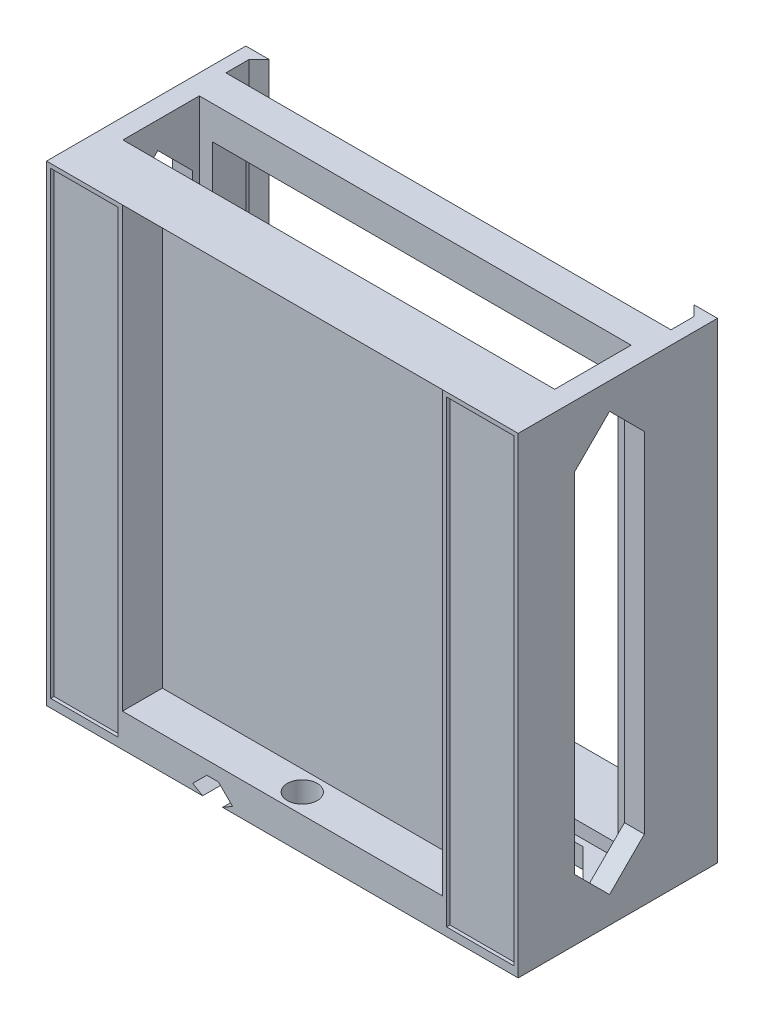
from build123d import *

# Parameters (mm, degrees)
SKETCH1_W            = 142
SKETCH1_H            = 142
SKETCH1_W_2          = 122
SKETCH1_H_2          = 122
BOSS_EXTRUDE1_DEPTH  = 10
SKETCH2_W            = 142
SKETCH2_H            = 10
BOSS_EXTRUDE2_DEPTH  = 10
BOSS_EXTRUDE3_DEPTH  = 132
BOSS_EXTRUDE4_DEPTH  = 2
SKETCH6_W            = 6
SKETCH6_H            = 8
BOSS_EXTRUDE5_DEPTH  = 21
BOSS_EXTRUDE6_DEPTH  = 142
BOSS_EXTRUDE7_DEPTH  = 6
BOSS_EXTRUDE8_DEPTH  = 6
SKETCH10_W           = 142
SKETCH10_H           = 142
BOSS_EXTRUDE9_DEPTH  = 12
BOSS_EXTRUDE14_DEPTH = 6
SKETCH13_R           = 4.5
CUT_EXTRUDE2_DEPTH   = 159.003164525
SKETCH14_W           = 20.32
SKETCH14_H           = 138.19
CUT_EXTRUDE3_DEPTH   = 1
CHAMFER4_SIZE        = 12
CUT_EXTRUDE4_DEPTH   = 117.970081645


with BuildPart() as part:
    # Sketch1 → Boss-Extrude1 (new body)
    with BuildSketch(Plane(origin=(0, 0, 0), x_dir=(0, 1, 0), z_dir=(0, 0, 1))):
        Rectangle(SKETCH1_W, SKETCH1_H)
        Rectangle(SKETCH1_W_2, SKETCH1_H_2, mode=Mode.SUBTRACT)
    extrude(amount=BOSS_EXTRUDE1_DEPTH)

    # Sketch2 → Boss-Extrude2 (add)
    with BuildSketch(Plane(origin=(0, 0, 0), x_dir=(1, 0, 0), z_dir=(0, 0, -1))):
        with Locations((0, 66)):
            Rectangle(SKETCH2_W, SKETCH2_H)
    extrude(amount=BOSS_EXTRUDE2_DEPTH)

    # Sketch3 → Boss-Extrude3 (add)
    with BuildSketch(Plane(origin=(0, -61, 0), x_dir=(-1, 0, 0), z_dir=(0, 1, 0))):
        Polygon((-67, -7), (-64, -10), (-71, -10), (-71, 0), (-67, 0), align=None)
        Polygon((64, -10), (71, -10), (71, 0), (67, 0), (67, -7), align=None)
    extrude(amount=BOSS_EXTRUDE3_DEPTH)

    # Sketch5 → Boss-Extrude4 (add)
    with BuildSketch(Plane.XY.offset(10)):
        Polygon((-65, -65), (65, -65), (65, 65), (65, 71), (71, 71), (71, 65), (71, -71), (-71, -71), (-71, 71), (-65, 71), (-65, 65), align=None)
    extrude(amount=BOSS_EXTRUDE4_DEPTH)

    # Sketch6 → Boss-Extrude5 (add)
    with BuildSketch(Plane.XY.offset(12)):
        with Locations((-68, 67)):
            Rectangle(SKETCH6_W, SKETCH6_H)
        Polygon((-65, -65), (-65, -63), (-71, -63), (-71, -71), (-63, -71), (-63, -65), align=None)
        Polygon((63, -71), (63, -65), (65, -65), (65, -63), (71, -63), (71, -71), align=None)
        with Locations((68, 67)):
            Rectangle(SKETCH6_W, SKETCH6_H)
    extrude(amount=BOSS_EXTRUDE5_DEPTH)

    # Sketch7 → Boss-Extrude6 (add)
    with BuildSketch(Plane.XZ.offset(71)):
        Polygon((-63, 33), (63, 33), (71, 33), (71, 38), (-71, 38), (-71, 33), align=None)
    extrude(amount=-BOSS_EXTRUDE6_DEPTH)

    # Sketch8 → Boss-Extrude7 (add)
    with BuildSketch(Plane.YZ.offset(71)):
        Polygon((63, 12), (63, 22.5), (52.5, 12), align=None)
        Polygon((52.5, 33), (63, 22.5), (63, 33), align=None)
    boss_extrude7 = extrude(amount=-BOSS_EXTRUDE7_DEPTH)

    # Sketch9 → Boss-Extrude8 (add)
    with BuildSketch(Plane(origin=(-71, 0, 0), x_dir=(0, -1, 0), z_dir=(-1, 0, 0))):
        Polygon((-52.5, 12), (-63, 22.5), (-63, 12), align=None)
        Polygon((-52.5, 33), (-63, 33), (-63, 22.5), align=None)
    boss_extrude8 = extrude(amount=-BOSS_EXTRUDE8_DEPTH)

    # Mirror4: Boss-Extrude7, Boss-Extrude8 across plane
    add(boss_extrude7.mirror(Plane.ZX))
    add(boss_extrude8.mirror(Plane.ZX))

    # Sketch10 → Boss-Extrude9 (add)
    with BuildSketch(Plane.XY.offset(38)):
        Rectangle(SKETCH10_W, SKETCH10_H)
        Polygon((-48.14, 59), (-48.14, -48.14), (-48.14, -61), (48.14, -61), (48.14, -48.14), (48.14, 59), align=None, mode=Mode.SUBTRACT)
    extrude(amount=BOSS_EXTRUDE9_DEPTH)

    # Sketch11 → Boss-Extrude14 (add)
    with BuildSketch(Plane.XZ.offset(71)):
        Polygon((-52.5, 12), (-63, 22.5), (-63, 12), align=None)
        Polygon((-63, 33), (-63, 22.5), (-52.5, 33), align=None)
    boss_extrude14 = extrude(amount=-BOSS_EXTRUDE14_DEPTH)

    # Mirror5: Boss-Extrude14 across plane
    add(boss_extrude14.mirror(Plane(origin=(0, 0, 0), x_dir=(0, 0, 1), z_dir=(1, 0, 0))))

    # Sketch13 → Cut-Extrude2 (cut, through all)
    with BuildSketch(Plane(origin=(0, -61, 0), x_dir=(-1, 0, 0), z_dir=(0, 1, 0))):
        with Locations(Location((0, 44, 0), (0, 0, 90))):
            Circle(SKETCH13_R)
    extrude(amount=-CUT_EXTRUDE2_DEPTH, mode=Mode.SUBTRACT)

    # Sketch14 → Cut-Extrude3 (cut)
    with BuildSketch(Plane.XY.offset(50)):
        with Locations((-59.57, 0.635)):
            Rectangle(SKETCH14_W, SKETCH14_H)
        with Locations((59.57, 0.635)):
            Rectangle(SKETCH14_W, SKETCH14_H)
    extrude(amount=-CUT_EXTRUDE3_DEPTH, mode=Mode.SUBTRACT)

    # Chamfer4
    chamfer4_edges = [part.edges().sort_by_distance(p)[0] for p in [
        (0, 59, 50),
    ]]
    chamfer(chamfer4_edges, length=CHAMFER4_SIZE - 0.0001)  # a hair under: the kernel refuses the full size

    # Sketch15 → Cut-Extrude4 (cut, through all)
    with BuildSketch(Plane.XY.offset(50)):
        Polygon((-24, -71), (-18, -71), (-15, -69.254896882), (-19.254896882, -65), (-22.745103118, -65), (-27, -69.254896882), align=None)
    extrude(amount=-CUT_EXTRUDE4_DEPTH, mode=Mode.SUBTRACT)


solid = part.part
